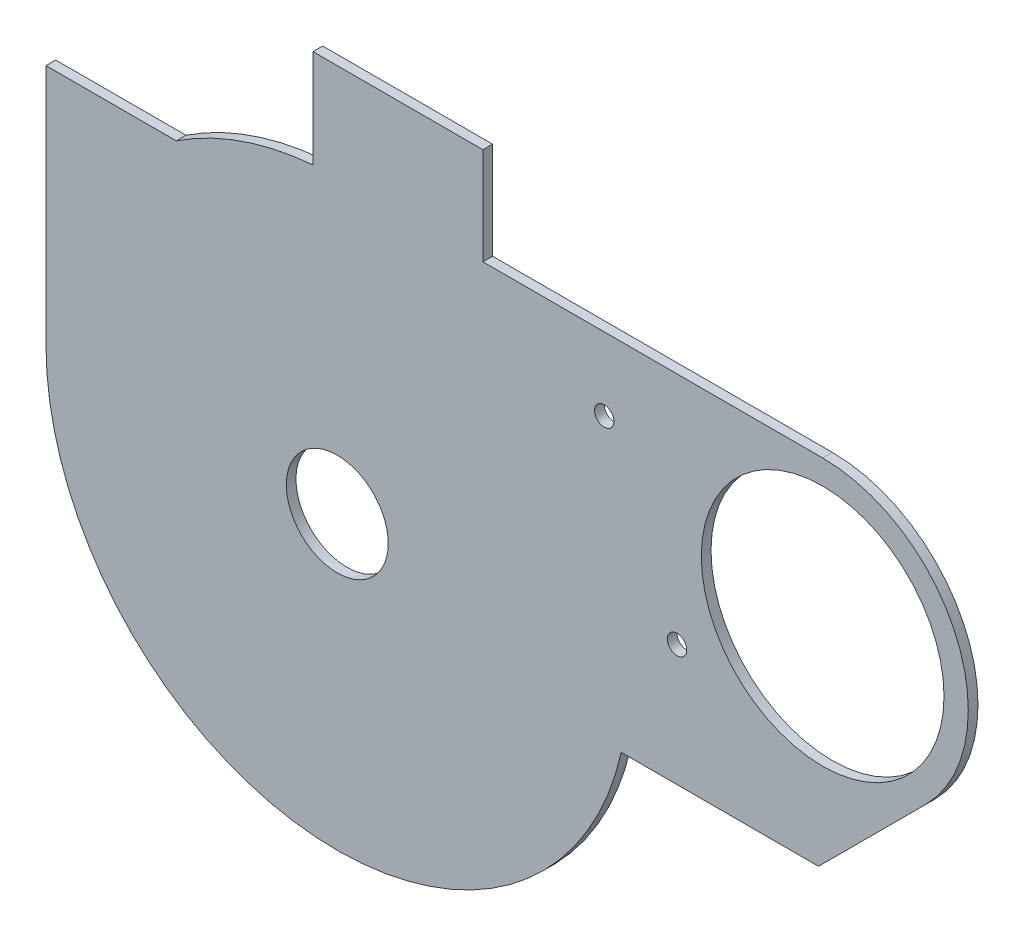
from build123d import *

# Parameters (mm, degrees)
SKETCH1_R           = 25
SKETCH1_R_2         = 10.5
BOSS_EXTRUDE1_DEPTH = 2
CUT_EXTRUDE1_REACH  = 145.192
SKETCH2_R           = 2
BOSS_EXTRUDE2_DEPTH = 2
BOSS_EXTRUDE3_DEPTH = 1


with BuildPart() as part:
    # Sketch1 → Boss-Extrude1 (new body)
    with BuildSketch(Plane.XY):
        with BuildLine():
            Line((-60, 50), (-60, 0))
            ThreePointArc((-60, 0), (-6.678621673, -59.627141576), (58.513200418, -13.274237334))
            Line((58.513200418, -13.274237334), (99.152169538, -13.274237334))
            Line((99.152169538, -13.274237334), (121.213203436, 8.786796564))
            ThreePointArc((121.213203436, 8.786796564), (127.716385975, 41.480502971), (100, 60))
            Line((100, 60), (0, 60))
            ThreePointArc((0, 60), (-17.320508076, 57.445626465), (-33.166247904, 50))
            Line((-33.166247904, 50), (-60, 50))
        make_face()
        with Locations((100, 30)):
            Circle(SKETCH1_R, mode=Mode.SUBTRACT)
        Circle(SKETCH1_R_2, mode=Mode.SUBTRACT)
    extrude(amount=BOSS_EXTRUDE1_DEPTH)

    # Sketch2 → Cut-Extrude1 (cut, up to next)
    with BuildSketch(Plane.XY.offset(2), mode=Mode.PRIVATE) as cut_extrude1_sk1:
        with Locations((55, 45)):
            Circle(SKETCH2_R)
    cut_extrude1_tool1 = extrude(cut_extrude1_sk1.sketch, amount=-CUT_EXTRUDE1_REACH, mode=Mode.PRIVATE) & part.part
    # Sketch2 → Cut-Extrude1 (cut, up to next)
    with BuildSketch(Plane.XY.offset(2), mode=Mode.PRIVATE) as cut_extrude1_sk2:
        with Locations((70, 11.725762666)):
            Circle(SKETCH2_R)
    cut_extrude1_tool2 = extrude(cut_extrude1_sk2.sketch, amount=-CUT_EXTRUDE1_REACH, mode=Mode.PRIVATE) & part.part
    add(cut_extrude1_tool1.solids().sort_by_distance((55, 45, 2))[0], mode=Mode.SUBTRACT)
    add(cut_extrude1_tool2.solids().sort_by_distance((70, 11.725763, 2))[0], mode=Mode.SUBTRACT)

    # Sketch3 → Boss-Extrude2 (add)
    with BuildSketch(Plane(origin=(0, 0, 0), x_dir=(-1, 0, 0), z_dir=(0, 0, -1))):
        with BuildLine():
            Line((-30, 80), (-30, 60))
            Line((-30, 60), (0, 60))
            ThreePointArc((0, 60), (2.502176759, 59.947803225), (5, 59.791303715))
            Line((5, 59.791303715), (5, 80))
            Line((5, 80), (-30, 80))
        make_face()
    extrude(amount=-BOSS_EXTRUDE2_DEPTH)

    # Sketch4 → Boss-Extrude3 (add)
    with BuildSketch(Plane(origin=(0, 0, 0), x_dir=(-1, 0, 0), z_dir=(0, 0, -1))):
        Polygon((-13.5, 65.596087829), (-20, 65.596087829), (-20, 63.596087829), (-13.5, 63.596087829), (-13.5, 57.096087829), (-11.5, 57.096087829), (-11.5, 63.596087829), (-5, 63.596087829), (-5, 65.596087829), (-11.5, 65.596087829), (-11.5, 72.096087829), (-13.5, 72.096087829), align=None)
    extrude(amount=BOSS_EXTRUDE3_DEPTH)


solid = part.part
